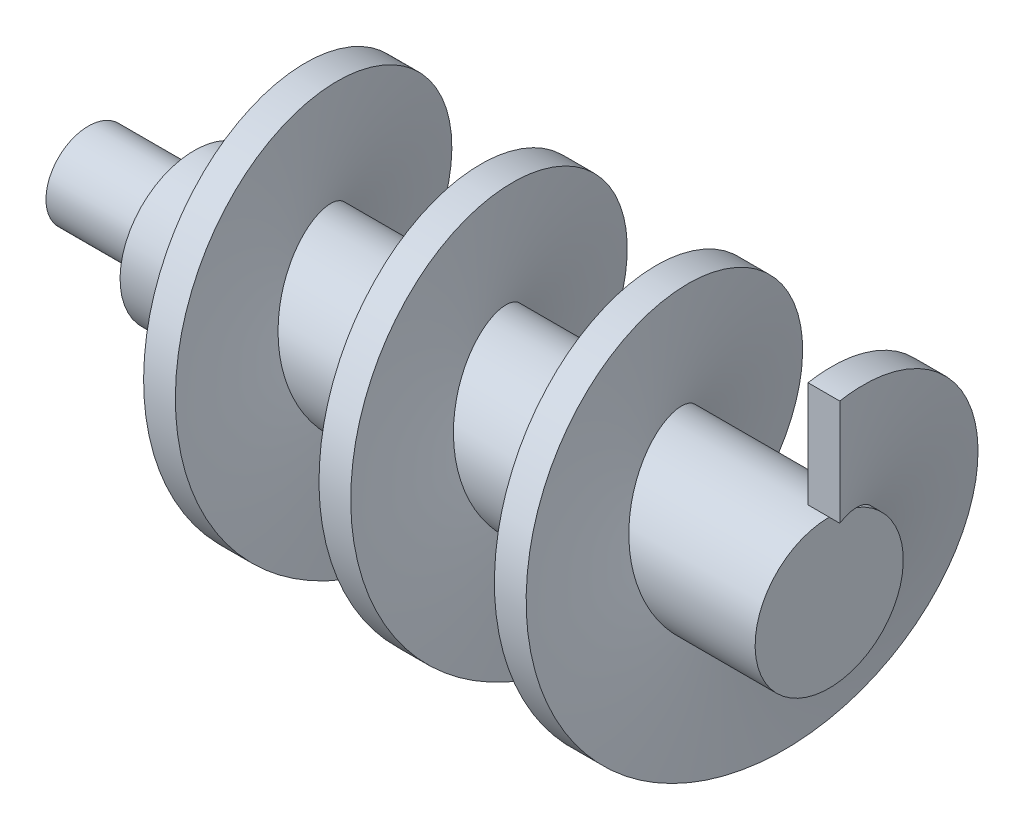
from build123d import *

# Parameters (mm, degrees)
BARRER1_PITCH = 16.571428571


with BuildPart() as part:
    # Croquis1 → Revolución1 (revolve)
    with BuildSketch(Plane.XY, mode=Mode.PRIVATE) as revoluci_n1_sk:
        Polygon((-25, 7), (35, 7), (35, 0), (-35, 0), (-35, 4), (-25, 4), align=None)
    revolve(revoluci_n1_sk.sketch.rotate(Axis((-81.749245703, 0, 0), (1, 0, 0)), 180), axis=Axis((-81.749245703, 0, 0), (1, 0, 0)))

    # Barrer1: the profile of Croquis3 profile screwed along a right-hand helix of 3.5 turns, 18 arcs to a turn; built about Z, then put on its axis
    barrer1_z = Axis((0, 0, 0), (0, 0, 1))
    barrer1_corners = [(6.9997, 0, 0), (6.9997, 0, 3), (17, 0, 3), (17, 0, 0)]
    with BuildLine(mode=Mode.PRIVATE) as barrer1_profile:
        Line(barrer1_corners[0], barrer1_corners[1])
        Line(barrer1_corners[1], barrer1_corners[2])
        Line(barrer1_corners[2], barrer1_corners[3])
        Line(barrer1_corners[3], barrer1_corners[0])
    barrer1_cap = Face(barrer1_profile.wire())
    barrer1_turn_angles = [0, 10, 20, 30, 40, 50, 60, 70, 80, 90, 100, 110, 120, 130, 140, 150, 160, 170, 180, 190, 200, 210, 220, 230, 240, 250, 260, 270, 280, 290, 300, 310, 320, 330, 340, 350, 360]
    barrer1_turn_weights = [1, 0.984807753012208, 1, 0.984807753012208, 1, 0.984807753012208, 1, 0.984807753012208, 1, 0.984807753012208, 1, 0.984807753012208, 1, 0.984807753012208, 1, 0.984807753012208, 1, 0.984807753012208, 1, 0.984807753012208, 1, 0.984807753012208, 1, 0.984807753012208, 1, 0.984807753012208, 1, 0.984807753012208, 1, 0.984807753012208, 1, 0.984807753012208, 1, 0.984807753012208, 1, 0.984807753012208, 1]
    barrer1_turn_rails = [Edge.make_bspline([Vector(p[0], p[1], 0).rotate(barrer1_z, barrer1_turn_angles[k]) / barrer1_turn_weights[k] + Vector(0, 0, p[2] + BARRER1_PITCH * barrer1_turn_angles[k] / 360) for k in range(37)], [0, 0, 0, 1, 1, 2, 2, 3, 3, 4, 4, 5, 5, 6, 6, 7, 7, 8, 8, 9, 9, 10, 10, 11, 11, 12, 12, 13, 13, 14, 14, 15, 15, 16, 16, 17, 17, 18, 18, 18], 2, barrer1_turn_weights) for p in barrer1_corners]
    barrer1_turn_sides = [Face.make_surface_from_curves(barrer1_turn_rails[p[0]], barrer1_turn_rails[p[1]]) for p in [(0, 1), (1, 2), (2, 3), (3, 0)]]
    barrer1_last_angles = [1080, 1090, 1100, 1110, 1120, 1130, 1140, 1150, 1160, 1170, 1180, 1190, 1200, 1210, 1220, 1230, 1240, 1250, 1260]
    barrer1_last_weights = [1, 0.984807753012208, 1, 0.984807753012208, 1, 0.984807753012208, 1, 0.984807753012208, 1, 0.984807753012208, 1, 0.984807753012208, 1, 0.984807753012208, 1, 0.984807753012208, 1, 0.9848077530122039, 1]
    barrer1_last_rails = [Edge.make_bspline([Vector(p[0], p[1], 0).rotate(barrer1_z, barrer1_last_angles[k]) / barrer1_last_weights[k] + Vector(0, 0, p[2] + BARRER1_PITCH * barrer1_last_angles[k] / 360) for k in range(19)], [0, 0, 0, 1, 1, 2, 2, 3, 3, 4, 4, 5, 5, 6, 6, 7, 7, 8, 8, 9, 9, 9], 2, barrer1_last_weights) for p in barrer1_corners]
    barrer1_last_sides = [Face.make_surface_from_curves(barrer1_last_rails[p[0]], barrer1_last_rails[p[1]]) for p in [(0, 1), (1, 2), (2, 3), (3, 0)]]
    barrer1 = Plane(origin=(-25, 0, 0), x_dir=(0, -1, 0), z_dir=(1, 0, 0)) * Solid(Shell([*[p.moved(Location((0, 0, BARRER1_PITCH * i))) for i in range(3) for p in barrer1_turn_sides], *barrer1_last_sides, barrer1_cap, barrer1_cap.rotate(barrer1_z, 1260).moved(Location((0, 0, BARRER1_PITCH * 1260 / 360)))]))
    add(barrer1)


solid = part.part
